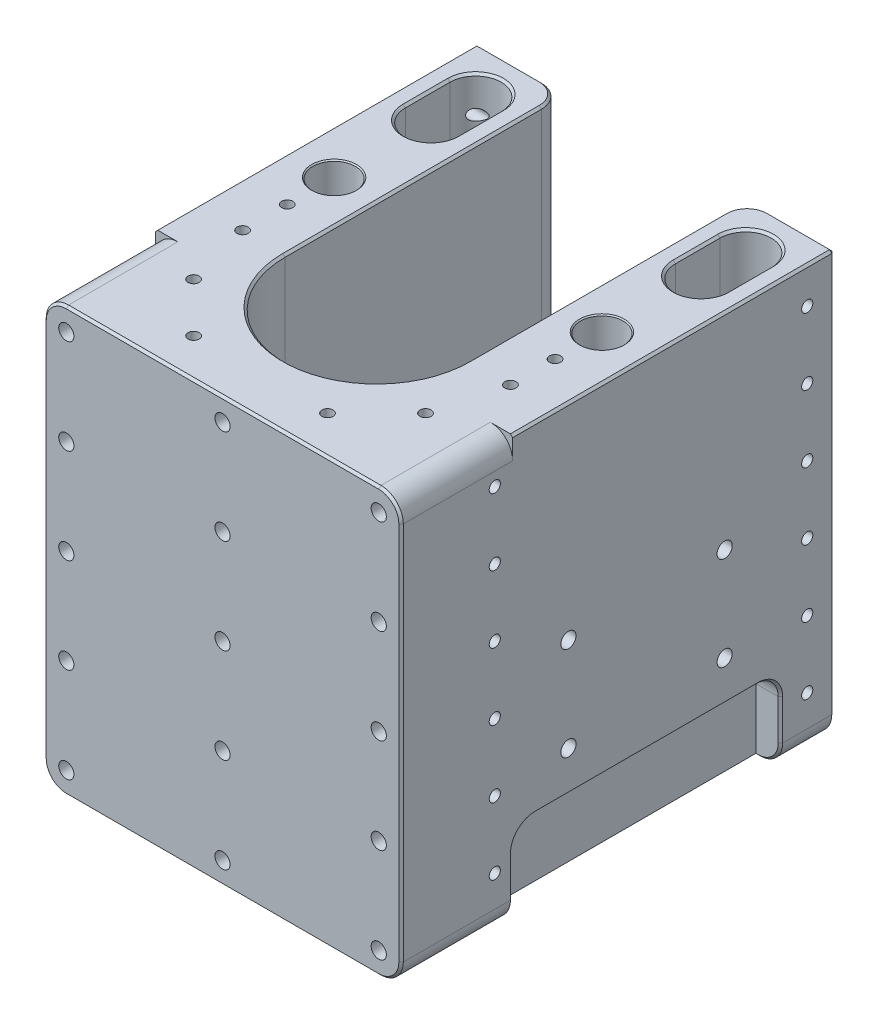
from build123d import *

# Parameters (mm, degrees)
BOSS_EXTRUDE1_DEPTH              = 190
SKETCH3_R                        = 9.55
CUT_EXTRUDE2_DEPTH               = 20
M8X1_25_TAPPED_HOLE1_AT_2_COUNT  = 2
M8X1_25_TAPPED_HOLE1_AT_2_PITCH  = 70
M8X1_25_TAPPED_HOLE1_AT_3_COUNT  = 2
M8X1_25_TAPPED_HOLE1_AT_3_PITCH  = 81.633326528
M8X1_25_TAPPED_HOLE1_AT_4_COUNT  = 2
M8X1_25_TAPPED_HOLE1_AT_4_PITCH  = 42
FILLET1_R                        = 10
SKETCH36_W                       = 33.761991249
SKETCH36_H                       = 120
SKETCH36_W_2                     = 53.52949171
CUT_EXTRUDE3_DEPTH               = 38
CBORE_FOR_M8_SHCS1_D             = 9
CBORE_FOR_M8_SHCS1_CBORE_D       = 15
CBORE_FOR_M8_SHCS1_CBORE_DEPTH   = 9
CHAMFER7_SIZE                    = 0.5
CHAMFER11_SIZE                   = 1
CHAMFER12_SIZE                   = 0.5
M8X1_25_TAPPED_HOLE3_D           = 6.8
M8X1_25_TAPPED_HOLE3_DEPTH       = 20
M8X1_25_TAPPED_HOLE3_CSINK_D     = 8.6
M8X1_25_TAPPED_HOLE3_CSINK_ANGLE = 90
M8X1_25_TAPPED_HOLE3_TIP         = 2.042926105
M6X1_0_TAPPED_HOLE1_D            = 5
M6X1_0_TAPPED_HOLE1_DEPTH        = 15
M6X1_0_TAPPED_HOLE1_CSINK_D      = 6.05
M6X1_0_TAPPED_HOLE1_CSINK_ANGLE  = 90
M6X1_0_TAPPED_HOLE1_TIP          = 1.502151548
CUT_EXTRUDE4_DEPTH               = 25
FILLET2_R                        = 10
CUT_EXTRUDE5_DEPTH               = 50
FILLET3_R                        = 10
CHAMFER3_SIZE                    = 1
CHAMFER15_SIZE                   = 1
CHAMFER16_SIZE                   = 1
M8X1_25_TAPPED_HOLE4_D           = 6.8
M8X1_25_TAPPED_HOLE4_DEPTH       = 20
M8X1_25_TAPPED_HOLE4_TIP         = 2.042926105
M6X1_0_TAPPED_HOLE2_D            = 5
M6X1_0_TAPPED_HOLE2_DEPTH        = 17
M6X1_0_TAPPED_HOLE2_TIP          = 1.502151548
M6X1_0_TAPPED_HOLE3_AT_2_COUNT   = 2
M6X1_0_TAPPED_HOLE3_AT_2_PITCH   = 30
M6X1_0_TAPPED_HOLE3_AT_3_COUNT   = 2
M6X1_0_TAPPED_HOLE3_AT_3_PITCH   = 60
M6X1_0_TAPPED_HOLE3_AT_4_COUNT   = 2
M6X1_0_TAPPED_HOLE3_AT_4_PITCH   = 90
M6X1_0_TAPPED_HOLE3_AT_5_COUNT   = 2
M6X1_0_TAPPED_HOLE3_AT_5_PITCH   = 140
M6X1_0_TAPPED_HOLE3_AT_6_COUNT   = 2
M6X1_0_TAPPED_HOLE3_AT_6_PITCH   = 143.178210633
M6X1_0_TAPPED_HOLE3_AT_7_COUNT   = 2
M6X1_0_TAPPED_HOLE3_AT_7_PITCH   = 152.315462117
M6X1_0_TAPPED_HOLE3_AT_8_COUNT   = 2
M6X1_0_TAPPED_HOLE3_AT_8_PITCH   = 166.433169771
M6X1_0_TAPPED_HOLE3_AT_9_COUNT   = 2
M6X1_0_TAPPED_HOLE3_AT_9_PITCH   = 120
M6X1_0_TAPPED_HOLE3_AT_10_COUNT  = 2
M6X1_0_TAPPED_HOLE3_AT_10_PITCH  = 150
M6X1_0_TAPPED_HOLE3_AT_11_COUNT  = 2
M6X1_0_TAPPED_HOLE3_AT_11_PITCH  = 184.390889146
M6X1_0_TAPPED_HOLE3_AT_12_COUNT  = 2
M6X1_0_TAPPED_HOLE3_AT_12_PITCH  = 205.182845287


with BuildPart() as part:
    # Sketch1 → Boss-Extrude1 (new body)
    with BuildSketch(Plane(origin=(0, 0, 0), x_dir=(1, 0, 0), z_dir=(0, 1, 0))):
        with BuildLine():
            Line((41, 97), (80, 97))
            Line((80, 97), (80, -97))
            Line((80, -97), (-80, -97))
            Line((-80, -97), (-80, 97))
            Line((-80, 97), (-41, 97))
            Line((-41, 97), (-41, -28))
            ThreePointArc((-41, -28), (0, -69), (41, -28))
            Line((41, -28), (41, 97))
        make_face()
    extrude(amount=BOSS_EXTRUDE1_DEPTH)

    # Sketch3 → Cut-Extrude2 (cut)
    with BuildSketch(Plane(origin=(0, 190, 0), x_dir=(1, 0, 0), z_dir=(0, 1, 0))):
        with Locations(Location((-60, 13, 0), (0, 0, 270))):
            Circle(SKETCH3_R)
        with Locations(Location((60, 13, 0), (0, 0, 270))):
            Circle(SKETCH3_R)
    extrude(amount=-CUT_EXTRUDE2_DEPTH, mode=Mode.SUBTRACT)

    # Sketch10 → M8x1.25 Tapped Hole1 (revolve, cut)
    with BuildSketch(Plane(origin=(80, 56, -48), x_dir=(0, 0, -1), z_dir=(0, 1, 0))):
        Polygon((0, 0), (0, 32.042926105), (3.4, 30), (3.4, 0), align=None)
    m8x1_25_tapped_hole1 = revolve(axis=Axis((86.35, 56, -48), (-1, 0, 0)), mode=Mode.SUBTRACT)

    # M8x1.25 Tapped Hole1 at 2: M8x1.25 Tapped Hole1 ×2
    with Locations(*[(0, 0, i * M8X1_25_TAPPED_HOLE1_AT_2_PITCH) for i in range(1, M8X1_25_TAPPED_HOLE1_AT_2_COUNT)]):
        add(m8x1_25_tapped_hole1, mode=Mode.SUBTRACT)

    # M8x1.25 Tapped Hole1 at 3: M8x1.25 Tapped Hole1 ×2
    with Locations(*[Vector(0, 0.5144957554275263, 0.8574929257125443) * (i * M8X1_25_TAPPED_HOLE1_AT_3_PITCH) for i in range(1, M8X1_25_TAPPED_HOLE1_AT_3_COUNT)]):
        add(m8x1_25_tapped_hole1, mode=Mode.SUBTRACT)

    # M8x1.25 Tapped Hole1 at 4: M8x1.25 Tapped Hole1 ×2
    with Locations(*[(0, i * M8X1_25_TAPPED_HOLE1_AT_4_PITCH, 0) for i in range(1, M8X1_25_TAPPED_HOLE1_AT_4_COUNT)]):
        add(m8x1_25_tapped_hole1, mode=Mode.SUBTRACT)

    # Mirror2: M8x1.25 Tapped Hole1 across plane
    add(m8x1_25_tapped_hole1.mirror(Plane(origin=(0, 0, 0), x_dir=(0, 0, 1), z_dir=(1, 0, 0))), mode=Mode.SUBTRACT)

    # Mirror2 copy 1 sketch → Mirror2 copy 1 (revolve, cut)
    with BuildSketch(Plane(origin=(-80, 56, 22), x_dir=(0, 0, -1), z_dir=(0, 1, 0))):
        Polygon((0, 0), (0, -32.042926105), (3.4, -30), (3.4, 0), align=None)
    revolve(axis=Axis((-86.35, 56, 22), (-1, 0, 0)), mode=Mode.SUBTRACT)

    # Mirror2 copy 2 sketch → Mirror2 copy 2 (revolve, cut)
    with BuildSketch(Plane(origin=(-80, 98, 22), x_dir=(0, 0, -1), z_dir=(0, 1, 0))):
        Polygon((0, 0), (0, -32.042926105), (3.4, -30), (3.4, 0), align=None)
    revolve(axis=Axis((-86.35, 98, 22), (-1, 0, 0)), mode=Mode.SUBTRACT)

    # Mirror2 copy 3 sketch → Mirror2 copy 3 (revolve, cut)
    with BuildSketch(Plane(origin=(-80, 98, -48), x_dir=(0, 0, -1), z_dir=(0, 1, 0))):
        Polygon((0, 0), (0, -32.042926105), (3.4, -30), (3.4, 0), align=None)
    revolve(axis=Axis((-86.35, 98, -48), (-1, 0, 0)), mode=Mode.SUBTRACT)

    # Fillet1
    fillet1_edges = [part.edges().sort_by_distance(p)[0] for p in [
        (-41, 95, -97),
        (41, 95, -97),
    ]]
    fillet(fillet1_edges, radius=FILLET1_R)

    # Sketch36 → Cut-Extrude3 (cut)
    with BuildSketch(Plane(origin=(0, 0, 0), x_dir=(1, 0, 0), z_dir=(0, 1, 0))):
        with Locations((-85.880995625, 13)):
            Rectangle(SKETCH36_W, SKETCH36_H)
        with Locations((95.764745855, 13)):
            Rectangle(SKETCH36_W_2, SKETCH36_H)
    extrude(amount=CUT_EXTRUDE3_DEPTH, mode=Mode.SUBTRACT)

    # CBORE for M8 SHCS1 (through all)
    with Locations(Plane(origin=(0, 0, 0), x_dir=(-1, 0, 0), z_dir=(0, -1, 0))):
        with Locations((60, 13), (-60, 13)):
            CounterBoreHole(CBORE_FOR_M8_SHCS1_D / 2, CBORE_FOR_M8_SHCS1_CBORE_D / 2, CBORE_FOR_M8_SHCS1_CBORE_DEPTH)

    # Chamfer7
    chamfer7_edges = [part.edges().sort_by_distance(p)[0] for p in [
        (-60, 190, -22.55),
        (60, 190, -22.55),
    ]]
    chamfer(chamfer7_edges, length=CHAMFER7_SIZE)

    # Chamfer11
    chamfer11_edges = [part.edges().sort_by_distance(p)[0] for p in [
        (67.5, 0, -13),
        (-52.5, 0, -13),
    ]]
    chamfer(chamfer11_edges, length=CHAMFER11_SIZE)

    # Chamfer12
    chamfer12_edges = [part.edges().sort_by_distance(p)[0] for p in [
        (55.5, 170, -13),
        (55.5, 9, -13),
        (-64.5, 170, -13),
        (-64.5, 9, -13),
    ]]
    chamfer(chamfer12_edges, length=CHAMFER12_SIZE)

    # M8x1.25 Tapped Hole3
    with Locations(Plane(origin=(0, 0, 0), x_dir=(-1, 0, 0), z_dir=(0, -1, 0))):
        with Locations((54, 57.5), (54, 27.5), (54, -2.5), (54, -32.5), (-54, 57.5), (-54, 27.5), (-54, -2.5), (-54, -32.5), (-54, -62.5), (54, -62.5)):
            CounterSinkHole(M8X1_25_TAPPED_HOLE3_D / 2, M8X1_25_TAPPED_HOLE3_CSINK_D / 2, depth=M8X1_25_TAPPED_HOLE3_DEPTH, counter_sink_angle=M8X1_25_TAPPED_HOLE3_CSINK_ANGLE)
            with Locations((0, 0, -(M8X1_25_TAPPED_HOLE3_DEPTH + M8X1_25_TAPPED_HOLE3_TIP / 2))):  # 118° drill point
                Cone(0, M8X1_25_TAPPED_HOLE3_D / 2, M8X1_25_TAPPED_HOLE3_TIP, mode=Mode.SUBTRACT)

    # M6x1.0 Tapped Hole1
    with Locations(Plane(origin=(0, 0, 0), x_dir=(-1, 0, 0), z_dir=(0, -1, 0))):
        with Locations((-60, -85), (-20, -85), (20, -85), (60, -85)):
            CounterSinkHole(M6X1_0_TAPPED_HOLE1_D / 2, M6X1_0_TAPPED_HOLE1_CSINK_D / 2, depth=M6X1_0_TAPPED_HOLE1_DEPTH, counter_sink_angle=M6X1_0_TAPPED_HOLE1_CSINK_ANGLE)
            with Locations((0, 0, -(M6X1_0_TAPPED_HOLE1_DEPTH + M6X1_0_TAPPED_HOLE1_TIP / 2))):  # 118° drill point
                Cone(0, M6X1_0_TAPPED_HOLE1_D / 2, M6X1_0_TAPPED_HOLE1_TIP, mode=Mode.SUBTRACT)

    # Sketch45 → Cut-Extrude4 (cut)
    with BuildSketch(Plane(origin=(0, 190, 0), x_dir=(1, 0, 0), z_dir=(0, 1, 0))):
        with BuildLine():
            Line((-72, 56.905108067), (-72, 76.905108067))
            ThreePointArc((-72, 76.905108067), (-60.5, 88.405108067), (-49, 76.905108067))
            Line((-49, 76.905108067), (-49, 56.905108067))
            ThreePointArc((-49, 56.905108067), (-60.5, 45.405108067), (-72, 56.905108067))
        make_face()
    cut_extrude4 = extrude(amount=-CUT_EXTRUDE4_DEPTH, mode=Mode.SUBTRACT)

    # Mirror3: Cut-Extrude4 across plane
    add(cut_extrude4.mirror(Plane(origin=(0, 0, 0), x_dir=(0, 0, 1), z_dir=(1, 0, 0))), mode=Mode.SUBTRACT)

    # Fillet2
    fillet2_edges = [part.edges().sort_by_distance(p)[0] for p in [
        (74.5, 38, -73),
        (74.5, 38, 47),
        (-74.5, 38, -73),
        (-74.5, 38, 47),
    ]]
    fillet(fillet2_edges, radius=FILLET2_R)

    # Sketch46 → Cut-Extrude5 (cut)
    with BuildSketch(Plane.XY.offset(97)):
        with BuildLine():
            Line((70, 190), (80, 190))
            Line((80, 190), (80, 180))
            ThreePointArc((80, 180), (77.071067812, 187.071067812), (70, 190))
        make_face()
    cut_extrude5 = extrude(amount=-CUT_EXTRUDE5_DEPTH, mode=Mode.SUBTRACT)

    # Mirror4: Cut-Extrude5 across plane
    add(cut_extrude5.mirror(Plane(origin=(0, 0, 0), x_dir=(0, 0, 1), z_dir=(1, 0, 0))), mode=Mode.SUBTRACT)

    # Fillet3
    fillet3_edges = [part.edges().sort_by_distance(p)[0] for p in [
        (80, 0, 72),
        (80, 0, -85),
        (-80, 0, -85),
        (-80, 0, 72),
    ]]
    fillet(fillet3_edges, radius=FILLET3_R)

    # Chamfer3
    chamfer3_edges = [part.edges().sort_by_distance(p)[0] for p in [
        (0, 0, 69),
        (-80, 100, -97),
        (80, 100, -97),
        (0, 190, 69),
        (-41, 190, -29.5),
        (-80, 190, -25),
        (80, 95, 97),
        (80, 190, -25),
        (77.071067812, 187.071067812, 97),
        (0, 190, 97),
        (-80, 95, 97),
        (-77.071067812, 187.071067812, 97),
        (60.5, 0, -97),
        (0, 0, 97),
        (-77.071067812, 2.928932188, -97),
        (77.071067812, 2.928932188, -97),
        (-77.071067812, 2.928932188, 97),
        (77.071067812, 2.928932188, 97),
        (41, 0, -29.5),
        (41, 190, -29.5),
        (-60.5, 0, -97),
        (-43.928932188, 0, -94.071067812),
        (43.928932188, 0, -94.071067812),
        (-65.5, 190, -97),
        (-43.928932188, 190, -94.071067812),
        (43.928932188, 190, -94.071067812),
        (65.5, 190, -97),
        (-41, 0, -29.5),
    ]]
    chamfer(chamfer3_edges, length=CHAMFER3_SIZE)

    # Chamfer15
    chamfer15_edges = [part.edges().sort_by_distance(p)[0] for p in [
        (-60.5, 190, -45.405108067),
        (-49, 190, -66.905108067),
        (-60.5, 190, -88.405108067),
        (-72, 190, -66.905108067),
        (60.5, 190, -45.405108067),
        (49, 190, -66.905108067),
        (60.5, 190, -88.405108067),
        (72, 190, -66.905108067),
    ]]
    chamfer(chamfer15_edges, length=CHAMFER15_SIZE)

    # Chamfer16
    # the kernel refuses this chamfer: 1 mm, written as the material it takes off along each edge
    with BuildSketch(Plane(origin=(69, 0, 47), x_dir=(0, 0.9996219169112968, -0.027495876610589075), z_dir=(1, 0, 0)), Plane(origin=(70, 0, -73), x_dir=(0, 0.999621916911297, 0.02749587661058218), z_dir=(-1, 0, 0))) as chamfer16_piece_1:
        Polygon((CHAMFER16_SIZE * 0.999621916911, CHAMFER16_SIZE * 0.0274958766106), (-CHAMFER16_SIZE * 0.0274958766106, CHAMFER16_SIZE * 0.999621916911), (0, 0), align=None)
    extrude(amount=1, mode=Mode.SUBTRACT)
    with BuildSketch(Plane(origin=(69, 0, -73), x_dir=(-0.9996219169112968, -0.027495876610586483, 0), z_dir=(0, 0, 1))) as chamfer16_piece_2:
        Polygon((CHAMFER16_SIZE * 0.999621916911, -CHAMFER16_SIZE * 0.0274958766106), (-CHAMFER16_SIZE * 0.0274958766106, -CHAMFER16_SIZE * 0.999621916911), (0, 0), align=None)
    extrude(amount=120, mode=Mode.SUBTRACT)
    with BuildSketch(Plane(origin=(80, 10, 47), x_dir=(0.027495876610582105, 0, 0.999621916911297), z_dir=(0, 1, 0)), Plane(origin=(80, 28, -73), x_dir=(0.02749587661058229, 0, -0.9996219169112968), z_dir=(0, -1, 0))) as chamfer16_piece_3:
        Polygon((CHAMFER16_SIZE * 0.999621916911, -CHAMFER16_SIZE * 0.0274958766106), (-CHAMFER16_SIZE * 0.0274958766106, -CHAMFER16_SIZE * 0.999621916911), (0, 0), align=None)
    extrude(amount=18, mode=Mode.SUBTRACT)
    with BuildSketch(Plane(origin=(80, 38, -63), x_dir=(0.027495876610582105, 0.999621916911297, 0), z_dir=(0, 0, 1))) as chamfer16_piece_4:
        Polygon((CHAMFER16_SIZE * 0.999621916911, CHAMFER16_SIZE * 0.0274958766106), (-CHAMFER16_SIZE * 0.0274958766106, CHAMFER16_SIZE * 0.999621916911), (0, 0), align=None)
    extrude(amount=100, mode=Mode.SUBTRACT)
    with BuildSketch(Plane(origin=(-80, 38, -63), x_dir=(-0.027495876610582105, 0.999621916911297, 0), z_dir=(0, 0, 1))) as chamfer16_piece_5:
        Polygon((CHAMFER16_SIZE * 0.999621916911, -CHAMFER16_SIZE * 0.0274958766106), (-CHAMFER16_SIZE * 0.0274958766106, -CHAMFER16_SIZE * 0.999621916911), (0, 0), align=None)
    extrude(amount=100, mode=Mode.SUBTRACT)
    with BuildSketch(Plane(origin=(-80, 28, -73), x_dir=(-0.02749587661058229, 0, -0.9996219169112968), z_dir=(0, -1, 0)), Plane(origin=(-80, 10, 47), x_dir=(-0.027495876610582105, 0, 0.999621916911297), z_dir=(0, 1, 0))) as chamfer16_piece_6:
        Polygon((CHAMFER16_SIZE * 0.999621916911, CHAMFER16_SIZE * 0.0274958766106), (-CHAMFER16_SIZE * 0.0274958766106, CHAMFER16_SIZE * 0.999621916911), (0, 0), align=None)
    extrude(amount=18, mode=Mode.SUBTRACT)
    with BuildSketch(Plane(origin=(80, 28, 37), x_dir=(0, 0, 1), z_dir=(0, -1, 0))) as chamfer16_piece_7:
        Polygon((10 + CHAMFER16_SIZE, 0), (10, CHAMFER16_SIZE), (10, 0), align=None)
    revolve(axis=Axis((80, 28, 37), (-1, 0, 0)), revolution_arc=90, mode=Mode.SUBTRACT)
    with BuildSketch(Plane(origin=(80, 28, -63), x_dir=(0, 0, -1), z_dir=(0, -1, 0))) as chamfer16_piece_8:
        Polygon((10 + CHAMFER16_SIZE, 0), (10, -CHAMFER16_SIZE), (10, 0), align=None)
    revolve(axis=Axis((80, 28, -63), (1, 0, 0)), revolution_arc=90, mode=Mode.SUBTRACT)
    with BuildSketch(Plane(origin=(-80, 28, 37), x_dir=(0, 0, 1), z_dir=(0, -1, 0))) as chamfer16_piece_9:
        Polygon((10 + CHAMFER16_SIZE, 0), (10, -CHAMFER16_SIZE), (10, 0), align=None)
    revolve(axis=Axis((-80, 28, 37), (-1, 0, 0)), revolution_arc=90, mode=Mode.SUBTRACT)
    with BuildSketch(Plane(origin=(-80, 28, -63), x_dir=(0, 0, -1), z_dir=(0, -1, 0))) as chamfer16_piece_10:
        Polygon((10 + CHAMFER16_SIZE, 0), (10, CHAMFER16_SIZE), (10, 0), align=None)
    revolve(axis=Axis((-80, 28, -63), (1, 0, 0)), revolution_arc=90, mode=Mode.SUBTRACT)
    with BuildSketch(Plane(origin=(-70, 10, -73), x_dir=(0, -1, 0), z_dir=(1, 0, 0))) as chamfer16_piece_11:
        Polygon((10, CHAMFER16_SIZE), (10 - CHAMFER16_SIZE, 0), (10, 0), align=None)
    revolve(axis=Axis((-70, 10, -73), (0, 0, -1)), revolution_arc=90, mode=Mode.SUBTRACT)
    with BuildSketch(Plane(origin=(70, 10, -73), x_dir=(1, 0, 0), z_dir=(0, 1, 0))) as chamfer16_piece_12:
        Polygon((10 - CHAMFER16_SIZE, 0), (10, CHAMFER16_SIZE), (10, 0), align=None)
    revolve(axis=Axis((70, 10, -73), (0, 0, -1)), revolution_arc=90, mode=Mode.SUBTRACT)
    with BuildSketch(Plane(origin=(70, 10, 47), x_dir=(1, 0, 0), z_dir=(0, 1, 0))) as chamfer16_piece_13:
        Polygon((10, -CHAMFER16_SIZE), (10 - CHAMFER16_SIZE, 0), (10, 0), align=None)
    revolve(axis=Axis((70, 10, 47), (0, 0, -1)), revolution_arc=90, mode=Mode.SUBTRACT)
    with BuildSketch(Plane(origin=(-70, 10, 47), x_dir=(0, -1, 0), z_dir=(1, 0, 0))) as chamfer16_piece_14:
        Polygon((10 - CHAMFER16_SIZE, 0), (10, -CHAMFER16_SIZE), (10, 0), align=None)
    revolve(axis=Axis((-70, 10, 47), (0, 0, -1)), revolution_arc=90, mode=Mode.SUBTRACT)
    with BuildSketch(Plane(origin=(-69, 0, 47), x_dir=(0, 0.9996219169112968, -0.02749587661058908), z_dir=(-1, 0, 0)), Plane(origin=(-70, 0, -73), x_dir=(0, 0.999621916911297, 0.02749587661058218), z_dir=(1, 0, 0))) as chamfer16_piece_15:
        Polygon((CHAMFER16_SIZE * 0.999621916911, -CHAMFER16_SIZE * 0.0274958766106), (-CHAMFER16_SIZE * 0.0274958766106, -CHAMFER16_SIZE * 0.999621916911), (0, 0), align=None)
    extrude(amount=1, mode=Mode.SUBTRACT)
    with BuildSketch(Plane(origin=(-69, 0, -73), x_dir=(0.9996219169112968, -0.027495876610586483, 0), z_dir=(0, 0, 1))) as chamfer16_piece_16:
        Polygon((CHAMFER16_SIZE * 0.999621916911, CHAMFER16_SIZE * 0.0274958766106), (-CHAMFER16_SIZE * 0.0274958766106, CHAMFER16_SIZE * 0.999621916911), (0, 0), align=None)
    extrude(amount=120, mode=Mode.SUBTRACT)
    with BuildSketch(Plane(origin=(66.428317012, 0, 47), x_dir=(0, 0.9996219169112968, -0.027495876610589075), z_dir=(1, 0, 0))) as chamfer16_piece_17a_section:
        Polygon((CHAMFER16_SIZE * 0.999621916911, CHAMFER16_SIZE * 0.0274958766106), (-CHAMFER16_SIZE * 0.0274958766106, CHAMFER16_SIZE * 0.999621916911), (0, 0), align=None)
    chamfer16_piece_17a = extrude(amount=3.571682988, mode=Mode.PRIVATE)
    chamfer16_piece_17a = split(chamfer16_piece_17a, bisect_by=Plane(origin=(69, 0.329793627, 47.329793627), z_dir=(-1, 0, 0)), keep=Keep.TOP, mode=Mode.PRIVATE)
    with BuildSketch(Plane(origin=(69, 0, -73), x_dir=(-0.9996219169112968, -0.027495876610586483, 0), z_dir=(0, 0, 1))) as chamfer16_piece_17b_section:
        Polygon((CHAMFER16_SIZE * 0.999621916911, -CHAMFER16_SIZE * 0.0274958766106), (-CHAMFER16_SIZE * 0.0274958766106, -CHAMFER16_SIZE * 0.999621916911), (0, 0), align=None)
    chamfer16_piece_17b = extrude(amount=122.571682988, mode=Mode.PRIVATE)
    chamfer16_piece_17b = split(chamfer16_piece_17b, bisect_by=Plane(origin=(68.670206373, 0.329793627, 47), z_dir=(0, 0, 1)), keep=Keep.TOP, mode=Mode.PRIVATE)
    chamfer16_piece_17 = chamfer16_piece_17a & chamfer16_piece_17b
    add(chamfer16_piece_17, mode=Mode.SUBTRACT)
    with BuildSketch(Plane(origin=(70, 0, -73), x_dir=(0, 0.999621916911297, 0.02749587661058218), z_dir=(-1, 0, 0))) as chamfer16_piece_18a_section:
        Polygon((CHAMFER16_SIZE * 0.999621916911, CHAMFER16_SIZE * 0.0274958766106), (-CHAMFER16_SIZE * 0.0274958766106, CHAMFER16_SIZE * 0.999621916911), (0, 0), align=None)
    chamfer16_piece_18a = extrude(amount=3.571682988, mode=Mode.PRIVATE)
    chamfer16_piece_18a = split(chamfer16_piece_18a, bisect_by=Plane(origin=(69, 0.329793627, -73.329793627), z_dir=(-1, 0, 0)), keep=Keep.TOP, mode=Mode.PRIVATE)
    with BuildSketch(Plane(origin=(69, 0, -75.571682988), x_dir=(-0.9996219169112968, -0.027495876610586483, 0), z_dir=(0, 0, 1))) as chamfer16_piece_18b_section:
        Polygon((CHAMFER16_SIZE * 0.999621916911, -CHAMFER16_SIZE * 0.0274958766106), (-CHAMFER16_SIZE * 0.0274958766106, -CHAMFER16_SIZE * 0.999621916911), (0, 0), align=None)
    chamfer16_piece_18b = extrude(amount=122.571682988, mode=Mode.PRIVATE)
    chamfer16_piece_18b = split(chamfer16_piece_18b, bisect_by=Plane(origin=(68.670206373, 0.329793627, -73), z_dir=(0, 0, -1)), keep=Keep.TOP, mode=Mode.PRIVATE)
    chamfer16_piece_18 = chamfer16_piece_18a & chamfer16_piece_18b
    add(chamfer16_piece_18, mode=Mode.SUBTRACT)
    with BuildSketch(Plane(origin=(-66.428317012, 0, 47), x_dir=(0, 0.9996219169112968, -0.02749587661058908), z_dir=(-1, 0, 0))) as chamfer16_piece_19a_section:
        Polygon((CHAMFER16_SIZE * 0.999621916911, -CHAMFER16_SIZE * 0.0274958766106), (-CHAMFER16_SIZE * 0.0274958766106, -CHAMFER16_SIZE * 0.999621916911), (0, 0), align=None)
    chamfer16_piece_19a = extrude(amount=3.571682988, mode=Mode.PRIVATE)
    chamfer16_piece_19a = split(chamfer16_piece_19a, bisect_by=Plane(origin=(-69, 0.329793627, 47.329793627), z_dir=(1, 0, 0)), keep=Keep.TOP, mode=Mode.PRIVATE)
    with BuildSketch(Plane(origin=(-69, 0, -73), x_dir=(0.9996219169112968, -0.027495876610586483, 0), z_dir=(0, 0, 1))) as chamfer16_piece_19b_section:
        Polygon((CHAMFER16_SIZE * 0.999621916911, CHAMFER16_SIZE * 0.0274958766106), (-CHAMFER16_SIZE * 0.0274958766106, CHAMFER16_SIZE * 0.999621916911), (0, 0), align=None)
    chamfer16_piece_19b = extrude(amount=122.571682988, mode=Mode.PRIVATE)
    chamfer16_piece_19b = split(chamfer16_piece_19b, bisect_by=Plane(origin=(-68.670206373, 0.329793627, 47), z_dir=(0, 0, 1)), keep=Keep.TOP, mode=Mode.PRIVATE)
    chamfer16_piece_19 = chamfer16_piece_19a & chamfer16_piece_19b
    add(chamfer16_piece_19, mode=Mode.SUBTRACT)
    with BuildSketch(Plane(origin=(-70, 0, -73), x_dir=(0, 0.999621916911297, 0.02749587661058218), z_dir=(1, 0, 0))) as chamfer16_piece_20a_section:
        Polygon((CHAMFER16_SIZE * 0.999621916911, -CHAMFER16_SIZE * 0.0274958766106), (-CHAMFER16_SIZE * 0.0274958766106, -CHAMFER16_SIZE * 0.999621916911), (0, 0), align=None)
    chamfer16_piece_20a = extrude(amount=3.571682988, mode=Mode.PRIVATE)
    chamfer16_piece_20a = split(chamfer16_piece_20a, bisect_by=Plane(origin=(-69, 0.329793627, -73.329793627), z_dir=(1, 0, 0)), keep=Keep.TOP, mode=Mode.PRIVATE)
    with BuildSketch(Plane(origin=(-69, 0, -75.571682988), x_dir=(0.9996219169112968, -0.027495876610586483, 0), z_dir=(0, 0, 1))) as chamfer16_piece_20b_section:
        Polygon((CHAMFER16_SIZE * 0.999621916911, CHAMFER16_SIZE * 0.0274958766106), (-CHAMFER16_SIZE * 0.0274958766106, CHAMFER16_SIZE * 0.999621916911), (0, 0), align=None)
    chamfer16_piece_20b = extrude(amount=122.571682988, mode=Mode.PRIVATE)
    chamfer16_piece_20b = split(chamfer16_piece_20b, bisect_by=Plane(origin=(-68.670206373, 0.329793627, -73), z_dir=(0, 0, -1)), keep=Keep.TOP, mode=Mode.PRIVATE)
    chamfer16_piece_20 = chamfer16_piece_20a & chamfer16_piece_20b
    add(chamfer16_piece_20, mode=Mode.SUBTRACT)

    # M8x1.25 Tapped Hole4
    with Locations(Plane.XY.offset(97)):
        with Locations((-70, 180), (0, 180), (70, 180), (70, 137.5), (70, 95), (70, 52.5), (70, 10), (0, 137.5), (0, 95), (0, 52.5), (0, 10), (-70, 137.5), (-70, 95), (-70, 52.5), (-70, 10)):
            Hole(M8X1_25_TAPPED_HOLE4_D / 2, depth=M8X1_25_TAPPED_HOLE4_DEPTH)
            with Locations((0, 0, -(M8X1_25_TAPPED_HOLE4_DEPTH + M8X1_25_TAPPED_HOLE4_TIP / 2))):  # 118° drill point
                Cone(0, M8X1_25_TAPPED_HOLE4_D / 2, M8X1_25_TAPPED_HOLE4_TIP, mode=Mode.SUBTRACT)

    # M6x1.0 Tapped Hole2
    with Locations(Plane(origin=(0, 190, 0), x_dir=(1, 0, 0), z_dir=(0, 1, 0))):
        with Locations((-60, -8), (-60, -28), (-51.961524227, -58), (-30, -79.961524227), (30, -79.961524227), (51.961524227, -58), (60, -28), (60, -8)):
            Hole(M6X1_0_TAPPED_HOLE2_D / 2, depth=M6X1_0_TAPPED_HOLE2_DEPTH)
            with Locations((0, 0, -(M6X1_0_TAPPED_HOLE2_DEPTH + M6X1_0_TAPPED_HOLE2_TIP / 2))):  # 118° drill point
                Cone(0, M6X1_0_TAPPED_HOLE2_D / 2, M6X1_0_TAPPED_HOLE2_TIP, mode=Mode.SUBTRACT)

    # Sketch54 → M6x1.0 Tapped Hole3 (revolve, cut)
    with BuildSketch(Plane(origin=(-80, 174, -85), x_dir=(0, 0, 1), z_dir=(0, 1, 0))):
        Polygon((0, 0), (0, 18.502151548), (2.5, 17), (2.5, 0), align=None)
    m6x1_0_tapped_hole3 = revolve(axis=Axis((-86.35, 174, -85), (1, 0, 0)), mode=Mode.SUBTRACT)

    # M6x1.0 Tapped Hole3 at 2: M6x1.0 Tapped Hole3 ×2
    with Locations(*[(0, -i * M6X1_0_TAPPED_HOLE3_AT_2_PITCH, 0) for i in range(1, M6X1_0_TAPPED_HOLE3_AT_2_COUNT)]):
        add(m6x1_0_tapped_hole3, mode=Mode.SUBTRACT)

    # M6x1.0 Tapped Hole3 at 3: M6x1.0 Tapped Hole3 ×2
    with Locations(*[(0, -i * M6X1_0_TAPPED_HOLE3_AT_3_PITCH, 0) for i in range(1, M6X1_0_TAPPED_HOLE3_AT_3_COUNT)]):
        add(m6x1_0_tapped_hole3, mode=Mode.SUBTRACT)

    # M6x1.0 Tapped Hole3 at 4: M6x1.0 Tapped Hole3 ×2
    with Locations(*[(0, -i * M6X1_0_TAPPED_HOLE3_AT_4_PITCH, 0) for i in range(1, M6X1_0_TAPPED_HOLE3_AT_4_COUNT)]):
        add(m6x1_0_tapped_hole3, mode=Mode.SUBTRACT)

    # M6x1.0 Tapped Hole3 at 5: M6x1.0 Tapped Hole3 ×2
    with Locations(*[(0, 0, i * M6X1_0_TAPPED_HOLE3_AT_5_PITCH) for i in range(1, M6X1_0_TAPPED_HOLE3_AT_5_COUNT)]):
        add(m6x1_0_tapped_hole3, mode=Mode.SUBTRACT)

    # M6x1.0 Tapped Hole3 at 6: M6x1.0 Tapped Hole3 ×2
    with Locations(*[Vector(0, -0.20952908873087328, 0.9778024140774095) * (i * M6X1_0_TAPPED_HOLE3_AT_6_PITCH) for i in range(1, M6X1_0_TAPPED_HOLE3_AT_6_COUNT)]):
        add(m6x1_0_tapped_hole3, mode=Mode.SUBTRACT)

    # M6x1.0 Tapped Hole3 at 7: M6x1.0 Tapped Hole3 ×2
    with Locations(*[Vector(0, -0.39391929857916747, 0.919145030018058) * (i * M6X1_0_TAPPED_HOLE3_AT_7_PITCH) for i in range(1, M6X1_0_TAPPED_HOLE3_AT_7_COUNT)]):
        add(m6x1_0_tapped_hole3, mode=Mode.SUBTRACT)

    # M6x1.0 Tapped Hole3 at 8: M6x1.0 Tapped Hole3 ×2
    with Locations(*[Vector(0, -0.5407575913134984, 0.8411784753765539) * (i * M6X1_0_TAPPED_HOLE3_AT_8_PITCH) for i in range(1, M6X1_0_TAPPED_HOLE3_AT_8_COUNT)]):
        add(m6x1_0_tapped_hole3, mode=Mode.SUBTRACT)

    # M6x1.0 Tapped Hole3 at 9: M6x1.0 Tapped Hole3 ×2
    with Locations(*[(0, -i * M6X1_0_TAPPED_HOLE3_AT_9_PITCH, 0) for i in range(1, M6X1_0_TAPPED_HOLE3_AT_9_COUNT)]):
        add(m6x1_0_tapped_hole3, mode=Mode.SUBTRACT)

    # M6x1.0 Tapped Hole3 at 10: M6x1.0 Tapped Hole3 ×2
    with Locations(*[(0, -i * M6X1_0_TAPPED_HOLE3_AT_10_PITCH, 0) for i in range(1, M6X1_0_TAPPED_HOLE3_AT_10_COUNT)]):
        add(m6x1_0_tapped_hole3, mode=Mode.SUBTRACT)

    # M6x1.0 Tapped Hole3 at 11: M6x1.0 Tapped Hole3 ×2
    with Locations(*[Vector(0, -0.6507913734559685, 0.7592566023652966) * (i * M6X1_0_TAPPED_HOLE3_AT_11_PITCH) for i in range(1, M6X1_0_TAPPED_HOLE3_AT_11_COUNT)]):
        add(m6x1_0_tapped_hole3, mode=Mode.SUBTRACT)

    # M6x1.0 Tapped Hole3 at 12: M6x1.0 Tapped Hole3 ×2
    with Locations(*[Vector(0, -0.731055268242869, 0.6823182503600111) * (i * M6X1_0_TAPPED_HOLE3_AT_12_PITCH) for i in range(1, M6X1_0_TAPPED_HOLE3_AT_12_COUNT)]):
        add(m6x1_0_tapped_hole3, mode=Mode.SUBTRACT)

    # Mirror5: M6x1.0 Tapped Hole3 across plane
    add(m6x1_0_tapped_hole3.mirror(Plane(origin=(0, 0, 0), x_dir=(0, 0, 1), z_dir=(1, 0, 0))), mode=Mode.SUBTRACT)

    # Mirror5 copy 1 sketch → Mirror5 copy 1 (revolve, cut)
    with BuildSketch(Plane(origin=(80, 144, -85), x_dir=(0, 0, 1), z_dir=(0, 1, 0))):
        Polygon((0, 0), (0, -18.502151548), (2.5, -17), (2.5, 0), align=None)
    revolve(axis=Axis((86.35, 144, -85), (1, 0, 0)), mode=Mode.SUBTRACT)

    # Mirror5 copy 2 sketch → Mirror5 copy 2 (revolve, cut)
    with BuildSketch(Plane(origin=(80, 114, -85), x_dir=(0, 0, 1), z_dir=(0, 1, 0))):
        Polygon((0, 0), (0, -18.502151548), (2.5, -17), (2.5, 0), align=None)
    revolve(axis=Axis((86.35, 114, -85), (1, 0, 0)), mode=Mode.SUBTRACT)

    # Mirror5 copy 3 sketch → Mirror5 copy 3 (revolve, cut)
    with BuildSketch(Plane(origin=(80, 84, -85), x_dir=(0, 0, 1), z_dir=(0, 1, 0))):
        Polygon((0, 0), (0, -18.502151548), (2.5, -17), (2.5, 0), align=None)
    revolve(axis=Axis((86.35, 84, -85), (1, 0, 0)), mode=Mode.SUBTRACT)

    # Mirror5 copy 4 sketch → Mirror5 copy 4 (revolve, cut)
    with BuildSketch(Plane(origin=(80, 174, 55), x_dir=(0, 0, 1), z_dir=(0, 1, 0))):
        Polygon((0, 0), (0, -18.502151548), (2.5, -17), (2.5, 0), align=None)
    revolve(axis=Axis((86.35, 174, 55), (1, 0, 0)), mode=Mode.SUBTRACT)

    # Mirror5 copy 5 sketch → Mirror5 copy 5 (revolve, cut)
    with BuildSketch(Plane(origin=(80, 144, 55), x_dir=(0, 0, 1), z_dir=(0, 1, 0))):
        Polygon((0, 0), (0, -18.502151548), (2.5, -17), (2.5, 0), align=None)
    revolve(axis=Axis((86.35, 144, 55), (1, 0, 0)), mode=Mode.SUBTRACT)

    # Mirror5 copy 6 sketch → Mirror5 copy 6 (revolve, cut)
    with BuildSketch(Plane(origin=(80, 114, 55), x_dir=(0, 0, 1), z_dir=(0, 1, 0))):
        Polygon((0, 0), (0, -18.502151548), (2.5, -17), (2.5, 0), align=None)
    revolve(axis=Axis((86.35, 114, 55), (1, 0, 0)), mode=Mode.SUBTRACT)

    # Mirror5 copy 7 sketch → Mirror5 copy 7 (revolve, cut)
    with BuildSketch(Plane(origin=(80, 84, 55), x_dir=(0, 0, 1), z_dir=(0, 1, 0))):
        Polygon((0, 0), (0, -18.502151548), (2.5, -17), (2.5, 0), align=None)
    revolve(axis=Axis((86.35, 84, 55), (1, 0, 0)), mode=Mode.SUBTRACT)

    # Mirror5 copy 8 sketch → Mirror5 copy 8 (revolve, cut)
    with BuildSketch(Plane(origin=(80, 54, -85), x_dir=(0, 0, 1), z_dir=(0, 1, 0))):
        Polygon((0, 0), (0, -18.502151548), (2.5, -17), (2.5, 0), align=None)
    revolve(axis=Axis((86.35, 54, -85), (1, 0, 0)), mode=Mode.SUBTRACT)

    # Mirror5 copy 9 sketch → Mirror5 copy 9 (revolve, cut)
    with BuildSketch(Plane(origin=(80, 24, -85), x_dir=(0, 0, 1), z_dir=(0, 1, 0))):
        Polygon((0, 0), (0, -18.502151548), (2.5, -17), (2.5, 0), align=None)
    revolve(axis=Axis((86.35, 24, -85), (1, 0, 0)), mode=Mode.SUBTRACT)

    # Mirror5 copy 10 sketch → Mirror5 copy 10 (revolve, cut)
    with BuildSketch(Plane(origin=(80, 54, 55), x_dir=(0, 0, 1), z_dir=(0, 1, 0))):
        Polygon((0, 0), (0, -18.502151548), (2.5, -17), (2.5, 0), align=None)
    revolve(axis=Axis((86.35, 54, 55), (1, 0, 0)), mode=Mode.SUBTRACT)

    # Mirror5 copy 11 sketch → Mirror5 copy 11 (revolve, cut)
    with BuildSketch(Plane(origin=(80, 24, 55), x_dir=(0, 0, 1), z_dir=(0, 1, 0))):
        Polygon((0, 0), (0, -18.502151548), (2.5, -17), (2.5, 0), align=None)
    revolve(axis=Axis((86.35, 24, 55), (1, 0, 0)), mode=Mode.SUBTRACT)


solid = part.part
